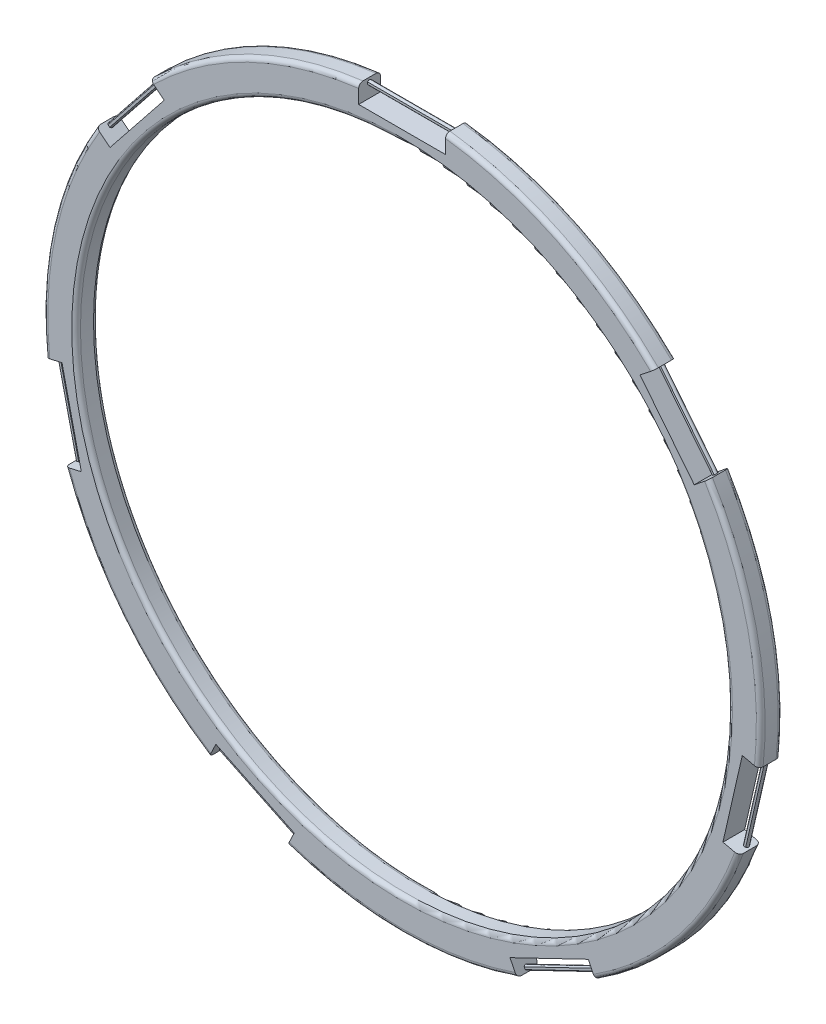
from build123d import *

# Parameters (mm, degrees)
SKETCH1_R                       = 82.5
BOSS_EXTRUDE1_DEPTH             = 2.5
FILLET1_R                       = 1
SKETCH2_W                       = 20
SKETCH2_H                       = 4.8
CUT_EXTRUDE1_DEPTH              = 117.699400172
BOSS_EXTRUDE2_REACH             = 118.699
BOSS_EXTRUDE2_DIRECTION_2_REACH = 118.699
CIRPATTERN1_START               = -10.214911446
CIRPATTERN1_OUTLINE_W           = 5.196504102
CIRPATTERN1_OUTLINE_H           = 8
CIRPATTERN1_DEPTH               = 20
CIRPATTERN1_2_DEPTH             = 0.159561387
CIRPATTERN1_START_2             = -9.732009811
CIRPATTERN1_3_OUTLINE_W         = 4.963950932
CIRPATTERN1_3_OUTLINE_H         = 8
CIRPATTERN1_3_DEPTH             = 20
CIRPATTERN1_START_3             = 10.069020394
CIRPATTERN1_4_DEPTH             = 0.198969795
CIRPATTERN1_START_4             = -9.880733146
CIRPATTERN1_5_OUTLINE_W         = 4.777457768
CIRPATTERN1_5_OUTLINE_H         = 8
CIRPATTERN1_5_DEPTH             = 20
CIRPATTERN1_START_5             = 10.030716965
CIRPATTERN1_6_DEPTH             = 0.088549889
CIRPATTERN1_START_6             = -10.119266854
CIRPATTERN1_7_OUTLINE_W         = 4.777457768
CIRPATTERN1_7_OUTLINE_H         = 8
CIRPATTERN1_7_DEPTH             = 20
CIRPATTERN1_8_DEPTH             = 0.088549889
CIRPATTERN1_START_7             = -10.267990189
CIRPATTERN1_9_OUTLINE_W         = 4.963950932
CIRPATTERN1_9_OUTLINE_H         = 8
CIRPATTERN1_9_DEPTH             = 20
CIRPATTERN1_10_DEPTH            = 0.198969795
CIRPATTERN1_START_8             = -9.785088554
CIRPATTERN1_11_OUTLINE_W        = 5.196504102
CIRPATTERN1_11_OUTLINE_H        = 8
CIRPATTERN1_11_DEPTH            = 20
CIRPATTERN1_START_9             = 10.055350059
CIRPATTERN1_12_DEPTH            = 0.159561387
CUT_EXTRUDE2_DEPTH              = 117.699400313
CUT_EXTRUDE2_DEPTH_BACK         = 117.699400313
SKETCH1_3_R                     = 75
FILLET2_R                       = 1


# Read off the part's stored shape, not the designer's step: CirPattern1
with BuildPart() as part:
    # Sketch1 → Boss-Extrude1 (new, symmetric)
    with BuildSketch(Plane.XY):
        Circle(SKETCH1_R)
    extrude(amount=BOSS_EXTRUDE1_DEPTH, both=True)

    # Fillet1
    fillet1_edges = [part.edges().sort_by_distance(p)[0] for p in [
        (-82.5, 0, -2.5),
        (-82.5, 0, 2.5),
    ]]
    fillet(fillet1_edges, radius=FILLET1_R)

    # Sketch2 → Cut-Extrude1 (cut, symmetric)
    with BuildSketch(Plane.XY):
        with Locations((0, 80.1)):
            Rectangle(SKETCH2_W, SKETCH2_H)
    extrude(amount=CUT_EXTRUDE1_DEPTH, both=True, mode=Mode.SUBTRACT)

    # Boss-Extrude2: up to this face of the body (flat: up to its plane)
    boss_extrude2_end = Plane(part.part.faces().sort_by_distance((10, 79.756437308, 0))[0])
    # Sketch3 → Boss-Extrude2 (add, up to the picked face)
    with BuildSketch(Plane(origin=(0, 0, 0), x_dir=(0, 0, -1), z_dir=(1, 0, 0)), mode=Mode.PRIVATE) as boss_extrude2_sk1:
        with BuildLine():
            Line((-0.433012702, 81.141696771), (-0.433012702, 80.641696771))
            ThreePointArc((-0.433012702, 80.641696771), (0, 80.391696771), (0.433012702, 80.641696771))
            Line((0.433012702, 80.641696771), (0.433012702, 81.141696771))
            ThreePointArc((0.433012702, 81.141696771), (0, 81.391696771), (-0.433012702, 81.141696771))
        make_face()
    boss_extrude2_tool1 = split(extrude(boss_extrude2_sk1.sketch, amount=BOSS_EXTRUDE2_REACH, mode=Mode.PRIVATE), bisect_by=boss_extrude2_end, keep=Keep.BOTH, mode=Mode.PRIVATE)
    add(boss_extrude2_tool1.solids().sort_by(Axis((0, 80.891697, 0), (1, 0, 0)))[0])

    # Boss-Extrude2 direction 2: up to this face of the body (flat: up to its plane)
    boss_extrude2_direction_2_end = Plane(part.part.faces().sort_by_distance((-10, 79.75643731, 0))[0])
    # Sketch3 → Boss-Extrude2 direction 2 (add, up to the picked face)
    with BuildSketch(Plane(origin=(0, 0, 0), x_dir=(0, 0, -1), z_dir=(1, 0, 0)), mode=Mode.PRIVATE) as boss_extrude2_direction_2_sk1:
        with BuildLine():
            Line((-0.433012702, 81.141696771), (-0.433012702, 80.641696771))
            ThreePointArc((-0.433012702, 80.641696771), (0, 80.391696771), (0.433012702, 80.641696771))
            Line((0.433012702, 80.641696771), (0.433012702, 81.141696771))
            ThreePointArc((0.433012702, 81.141696771), (0, 81.391696771), (-0.433012702, 81.141696771))
        make_face()
    boss_extrude2_direction_2_tool1 = split(extrude(boss_extrude2_direction_2_sk1.sketch, amount=-BOSS_EXTRUDE2_DIRECTION_2_REACH, mode=Mode.PRIVATE), bisect_by=boss_extrude2_direction_2_end, keep=Keep.BOTH, mode=Mode.PRIVATE)
    add(boss_extrude2_direction_2_tool1.solids().sort_by(Axis((0, 80.891697, 0), (-1, 0, 0)))[0])

    # CirPattern1 outline → CirPattern1 (cut)
    with BuildSketch(Plane(origin=(0, 0, 0), x_dir=(0.7818314824680309, -0.623489801858732, 0), z_dir=(0.623489801858732, 0.781831482468031, 0)).offset(CIRPATTERN1_START)):
        with Locations((-80.401747949, 0)):
            Rectangle(CIRPATTERN1_OUTLINE_W, CIRPATTERN1_OUTLINE_H)
        with BuildLine():
            ThreePointArc((-80.668351954, 0.433012702), (-80.418351954, 0), (-80.668351954, -0.433012702))
            Line((-80.668351954, -0.433012702), (-81.168351954, -0.433012702))
            ThreePointArc((-81.168351954, -0.433012702), (-81.418351954, 0), (-81.168351954, 0.433012702))
            Line((-81.168351954, 0.433012702), (-80.668351954, 0.433012702))
        make_face(mode=Mode.SUBTRACT)
    extrude(amount=CIRPATTERN1_DEPTH, mode=Mode.SUBTRACT)

    # CirPattern1 2 outline → CirPattern1 2 (cut)
    with BuildSketch(Plane(origin=(0, 0, 0), x_dir=(0.7818314824680309, -0.623489801858732, 0), z_dir=(0.623489801858732, 0.781831482468031, 0)).offset(CIRPATTERN1_START)):
        with BuildLine():
            Line((-81.168351954, -0.433012702), (-80.668351954, -0.433012702))
            ThreePointArc((-80.668351954, -0.433012702), (-80.418351954, 0), (-80.668351954, 0.433012702))
            Line((-80.668351954, 0.433012702), (-81.168351954, 0.433012702))
            ThreePointArc((-81.168351954, 0.433012702), (-81.418351954, 0), (-81.168351954, -0.433012702))
        make_face()
    extrude(amount=CIRPATTERN1_2_DEPTH, mode=Mode.SUBTRACT)

    # CirPattern1 3 outline → CirPattern1 3 (cut)
    with BuildSketch(Plane(origin=(0, 0, 0), x_dir=(0.9749279121818228, 0.222520933956318, 0), z_dir=(0.22252093395631797, -0.9749279121818228, 0)).offset(CIRPATTERN1_START_2)):
        with Locations((-80.518024534, 0)):
            Rectangle(CIRPATTERN1_3_OUTLINE_W, CIRPATTERN1_3_OUTLINE_H)
        with BuildLine():
            ThreePointArc((-81.228245608, -0.433012702), (-81.478245608, 0), (-81.228245608, 0.433012702))
            Line((-81.228245608, 0.433012702), (-80.728245608, 0.433012702))
            ThreePointArc((-80.728245608, 0.433012702), (-80.478245608, 0), (-80.728245608, -0.433012702))
            Line((-80.728245608, -0.433012702), (-81.228245608, -0.433012702))
        make_face(mode=Mode.SUBTRACT)
    extrude(amount=CIRPATTERN1_3_DEPTH, mode=Mode.SUBTRACT)

    # CirPattern1 4 outline → CirPattern1 4 (cut)
    with BuildSketch(Plane(origin=(0, 0, 0), x_dir=(0.9749279121818228, 0.222520933956318, 0), z_dir=(0.22252093395631797, -0.9749279121818228, 0)).offset(CIRPATTERN1_START_3)):
        with BuildLine():
            Line((-80.728245608, 0.433012702), (-81.228245608, 0.433012702))
            ThreePointArc((-81.228245608, 0.433012702), (-81.478245608, 0), (-81.228245608, -0.433012702))
            Line((-81.228245608, -0.433012702), (-80.728245608, -0.433012702))
            ThreePointArc((-80.728245608, -0.433012702), (-80.478245608, 0), (-80.728245608, 0.433012702))
        make_face()
    extrude(amount=CIRPATTERN1_4_DEPTH, mode=Mode.SUBTRACT)

    # CirPattern1 5 outline → CirPattern1 5 (cut)
    with BuildSketch(Plane(origin=(0, 0, 0), x_dir=(0.43388373911755285, 0.9009688679024216, 0), z_dir=(0.9009688679024217, -0.4338837391175529, 0)).offset(CIRPATTERN1_START_4)):
        with Locations((-80.611271116, 0)):
            Rectangle(CIRPATTERN1_5_OUTLINE_W, CIRPATTERN1_5_OUTLINE_H)
        with BuildLine():
            ThreePointArc((-81.276276589, -0.433012702), (-81.526276589, 0), (-81.276276589, 0.433012702))
            Line((-81.276276589, 0.433012702), (-80.776276589, 0.433012702))
            ThreePointArc((-80.776276589, 0.433012702), (-80.526276589, 0), (-80.776276589, -0.433012702))
            Line((-80.776276589, -0.433012702), (-81.276276589, -0.433012702))
        make_face(mode=Mode.SUBTRACT)
    extrude(amount=CIRPATTERN1_5_DEPTH, mode=Mode.SUBTRACT)

    # CirPattern1 6 outline → CirPattern1 6 (cut)
    with BuildSketch(Plane(origin=(0, 0, 0), x_dir=(0.43388373911755285, 0.9009688679024216, 0), z_dir=(0.9009688679024217, -0.4338837391175529, 0)).offset(CIRPATTERN1_START_5)):
        with BuildLine():
            Line((-80.776276589, 0.433012702), (-81.276276589, 0.433012702))
            ThreePointArc((-81.276276589, 0.433012702), (-81.526276589, 0), (-81.276276589, -0.433012702))
            Line((-81.276276589, -0.433012702), (-80.776276589, -0.433012702))
            ThreePointArc((-80.776276589, -0.433012702), (-80.526276589, 0), (-80.776276589, 0.433012702))
        make_face()
    extrude(amount=CIRPATTERN1_6_DEPTH, mode=Mode.SUBTRACT)

    # CirPattern1 7 outline → CirPattern1 7 (cut)
    with BuildSketch(Plane(origin=(0, 0, 0), x_dir=(-0.433883739117565, 0.9009688679024158, 0), z_dir=(0.9009688679024159, 0.43388373911756495, 0)).offset(CIRPATTERN1_START_6)):
        with Locations((-80.611271116, 0)):
            Rectangle(CIRPATTERN1_7_OUTLINE_W, CIRPATTERN1_7_OUTLINE_H)
        with BuildLine():
            ThreePointArc((-81.276276589, -0.433012702), (-81.526276589, 0), (-81.276276589, 0.433012702))
            Line((-81.276276589, 0.433012702), (-80.776276589, 0.433012702))
            ThreePointArc((-80.776276589, 0.433012702), (-80.526276589, 0), (-80.776276589, -0.433012702))
            Line((-80.776276589, -0.433012702), (-81.276276589, -0.433012702))
        make_face(mode=Mode.SUBTRACT)
    extrude(amount=CIRPATTERN1_7_DEPTH, mode=Mode.SUBTRACT)

    # CirPattern1 8 outline → CirPattern1 8 (cut)
    with BuildSketch(Plane(origin=(0, 0, 0), x_dir=(-0.433883739117565, 0.9009688679024158, 0), z_dir=(0.9009688679024159, 0.43388373911756495, 0)).offset(CIRPATTERN1_START_6)):
        with BuildLine():
            Line((-80.776276589, 0.433012702), (-81.276276589, 0.433012702))
            ThreePointArc((-81.276276589, 0.433012702), (-81.526276589, 0), (-81.276276589, -0.433012702))
            Line((-81.276276589, -0.433012702), (-80.776276589, -0.433012702))
            ThreePointArc((-80.776276589, -0.433012702), (-80.526276589, 0), (-80.776276589, 0.433012702))
        make_face()
    extrude(amount=CIRPATTERN1_8_DEPTH, mode=Mode.SUBTRACT)

    # CirPattern1 9 outline → CirPattern1 9 (cut)
    with BuildSketch(Plane(origin=(0, 0, 0), x_dir=(0.9749279121818257, -0.222520933956305, 0), z_dir=(0.22252093395630498, 0.9749279121818258, 0)).offset(CIRPATTERN1_START_7)):
        with Locations((80.518024534, 0)):
            Rectangle(CIRPATTERN1_9_OUTLINE_W, CIRPATTERN1_9_OUTLINE_H)
        with BuildLine():
            ThreePointArc((81.228245608, 0.433012702), (81.478245608, 0), (81.228245608, -0.433012702))
            Line((81.228245608, -0.433012702), (80.728245608, -0.433012702))
            ThreePointArc((80.728245608, -0.433012702), (80.478245608, 0), (80.728245608, 0.433012702))
            Line((80.728245608, 0.433012702), (81.228245608, 0.433012702))
        make_face(mode=Mode.SUBTRACT)
    extrude(amount=CIRPATTERN1_9_DEPTH, mode=Mode.SUBTRACT)

    # CirPattern1 10 outline → CirPattern1 10 (cut)
    with BuildSketch(Plane(origin=(0, 0, 0), x_dir=(0.9749279121818257, -0.222520933956305, 0), z_dir=(0.22252093395630498, 0.9749279121818258, 0)).offset(CIRPATTERN1_START_7)):
        with BuildLine():
            Line((80.728245608, -0.433012702), (81.228245608, -0.433012702))
            ThreePointArc((81.228245608, -0.433012702), (81.478245608, 0), (81.228245608, 0.433012702))
            Line((81.228245608, 0.433012702), (80.728245608, 0.433012702))
            ThreePointArc((80.728245608, 0.433012702), (80.478245608, 0), (80.728245608, -0.433012702))
        make_face()
    extrude(amount=CIRPATTERN1_10_DEPTH, mode=Mode.SUBTRACT)

    # CirPattern1 11 outline → CirPattern1 11 (cut)
    with BuildSketch(Plane(origin=(0, 0, 0), x_dir=(0.7818314824680221, 0.6234898018587431, 0), z_dir=(0.6234898018587431, -0.7818314824680221, 0)).offset(CIRPATTERN1_START_8)):
        with Locations((80.401747949, 0)):
            Rectangle(CIRPATTERN1_11_OUTLINE_W, CIRPATTERN1_11_OUTLINE_H)
        with BuildLine():
            ThreePointArc((80.668351954, -0.433012702), (80.418351954, 0), (80.668351954, 0.433012702))
            Line((80.668351954, 0.433012702), (81.168351954, 0.433012702))
            ThreePointArc((81.168351954, 0.433012702), (81.418351954, 0), (81.168351954, -0.433012702))
            Line((81.168351954, -0.433012702), (80.668351954, -0.433012702))
        make_face(mode=Mode.SUBTRACT)
    extrude(amount=CIRPATTERN1_11_DEPTH, mode=Mode.SUBTRACT)

    # CirPattern1 12 outline → CirPattern1 12 (cut)
    with BuildSketch(Plane(origin=(0, 0, 0), x_dir=(0.7818314824680221, 0.6234898018587431, 0), z_dir=(0.6234898018587431, -0.7818314824680221, 0)).offset(CIRPATTERN1_START_9)):
        with BuildLine():
            Line((81.168351954, 0.433012702), (80.668351954, 0.433012702))
            ThreePointArc((80.668351954, 0.433012702), (80.418351954, 0), (80.668351954, -0.433012702))
            Line((80.668351954, -0.433012702), (81.168351954, -0.433012702))
            ThreePointArc((81.168351954, -0.433012702), (81.418351954, 0), (81.168351954, 0.433012702))
        make_face()
    extrude(amount=CIRPATTERN1_12_DEPTH, mode=Mode.SUBTRACT)

    # Sketch1<3> → Cut-Extrude2 (cut, two sides: drawn at the far end of the back side and taken through both)
    with BuildSketch(Plane.XY.offset(-CUT_EXTRUDE2_DEPTH_BACK)):
        Circle(SKETCH1_3_R)
    extrude(amount=CUT_EXTRUDE2_DEPTH + CUT_EXTRUDE2_DEPTH_BACK, mode=Mode.SUBTRACT)

    # Fillet2
    fillet2_edges = [part.edges().sort_by_distance(p)[0] for p in [
        (-75, 0, -2.5),
        (-75, 0, 2.5),
    ]]
    fillet(fillet2_edges, radius=FILLET2_R)


solid = part.part
